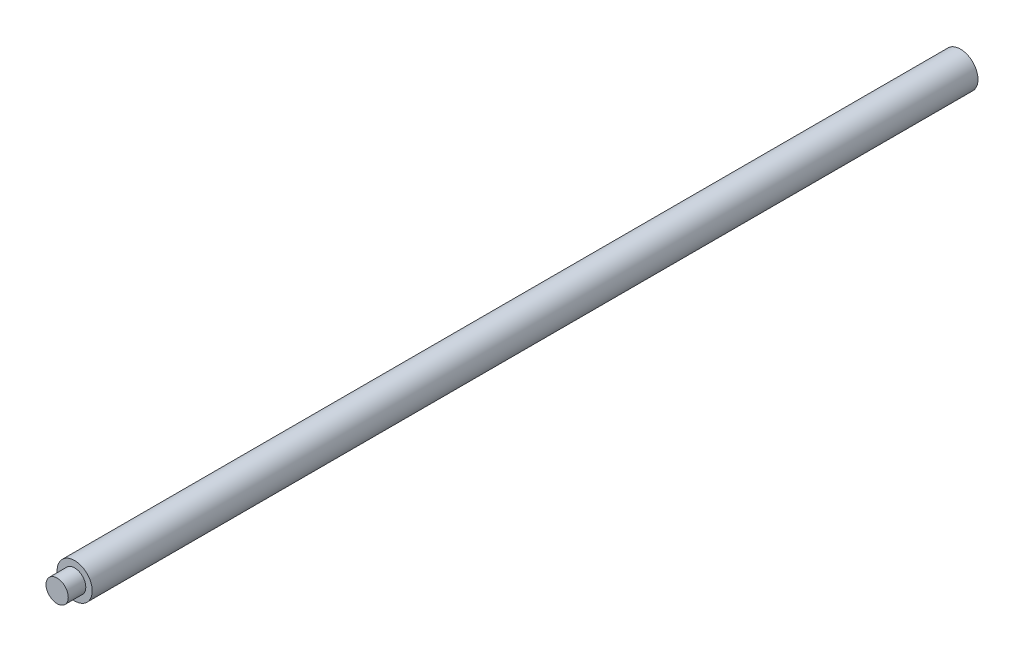
from build123d import *

# Parameters (mm, degrees)
SKETCH1_R           = 10
SKETCH1_R_2         = 8
BOSS_EXTRUDE1_DEPTH = 495
SKETCH2_R           = 10
BOSS_EXTRUDE2_DEPTH = 10
SKETCH3_R           = 6.35
BOSS_EXTRUDE3_DEPTH = 10


with BuildPart() as part:
    # Sketch1 → Boss-Extrude1 (new body)
    with BuildSketch(Plane.XY):
        Circle(SKETCH1_R)
        Circle(SKETCH1_R_2, mode=Mode.SUBTRACT)
    extrude(amount=BOSS_EXTRUDE1_DEPTH)

    # Sketch2 → Boss-Extrude2 (add)
    with BuildSketch(Plane.XY.offset(495)):
        Circle(SKETCH2_R)
    extrude(amount=BOSS_EXTRUDE2_DEPTH)

    # Sketch3 → Boss-Extrude3 (add)
    with BuildSketch(Plane.XY.offset(505)):
        Circle(SKETCH3_R)
    extrude(amount=BOSS_EXTRUDE3_DEPTH)


solid = part.part
